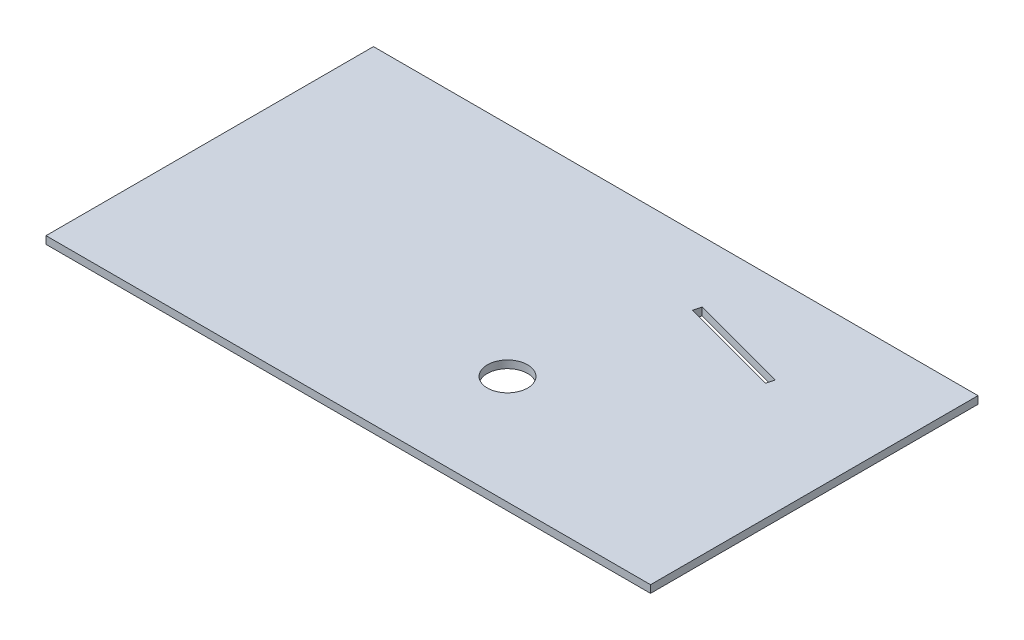
from build123d import *

# Parameters (mm, degrees)
BOSS_EXTRUDE1_DEPTH    = 50.8
SKETCH4_W              = 1524
SKETCH4_H              = 825.5
BOSS_EXTRUDE2_DEPTH    = 19.05
F_20_0MM_DOWEL_HOLE1_D = 101.6
SKETCH8_W              = 1.5875
SKETCH8_H              = 50.8
BOSS_EXTRUDE3_DEPTH    = 204
CUT_EXTRUDE1_DEPTH     = 1048.186527675


with BuildPart() as part:
    # Sketch3 → Boss-Extrude1 (new body)
    with BuildSketch(Plane(origin=(0, 0, 0), x_dir=(1, 0, 0), z_dir=(0, 1, 0))):
        with BuildLine():
            Line((-524, 0), (-525.5875, 0))
            ThreePointArc((-525.5875, 0), (-255.243310314, 459.448661655), (277.677694458, 446.248045549))
            Line((277.677694458, 446.248045549), (277.677694458, 444.377202386))
            ThreePointArc((277.677694458, 444.377202386), (-254.040241009, 458.300726541), (-524, 0))
        make_face()
    extrude(amount=BOSS_EXTRUDE1_DEPTH)

    # Sketch4 → Boss-Extrude2 (add)
    with BuildSketch(Plane(origin=(0, 50.8, 0), x_dir=(1, 0, 0), z_dir=(0, 1, 0))):
        with Locations((-127, 138.338)):
            Rectangle(SKETCH4_W, SKETCH4_H)
    extrude(amount=BOSS_EXTRUDE2_DEPTH)

    # Ø20.0mm Dowel Hole1 (through all)
    with Locations(Plane(origin=(0, 50.8, 0), x_dir=(-1, 0, 0), z_dir=(0, -1, 0))):
        with Locations((0, 0)):
            Hole(F_20_0MM_DOWEL_HOLE1_D / 2)

    # Sketch8 → Boss-Extrude3 (add)
    with BuildSketch(Plane.XY):
        with Locations((-524.79375, 25.4)):
            Rectangle(SKETCH8_W, SKETCH8_H)
    extrude(amount=BOSS_EXTRUDE3_DEPTH)

    # Sketch9 → Cut-Extrude1 (cut, through all)
    with BuildSketch(Plane(origin=(0, 50.8, 0), x_dir=(-1, 0, 0), z_dir=(0, -1, 0))):
        Polygon((-94.035666067, 396.611468252), (-345.176380902, 329.318516526), (-340, 310), (-88.859285165, 377.292951727), align=None)
    extrude(amount=-CUT_EXTRUDE1_DEPTH, mode=Mode.SUBTRACT)


solid = part.part
